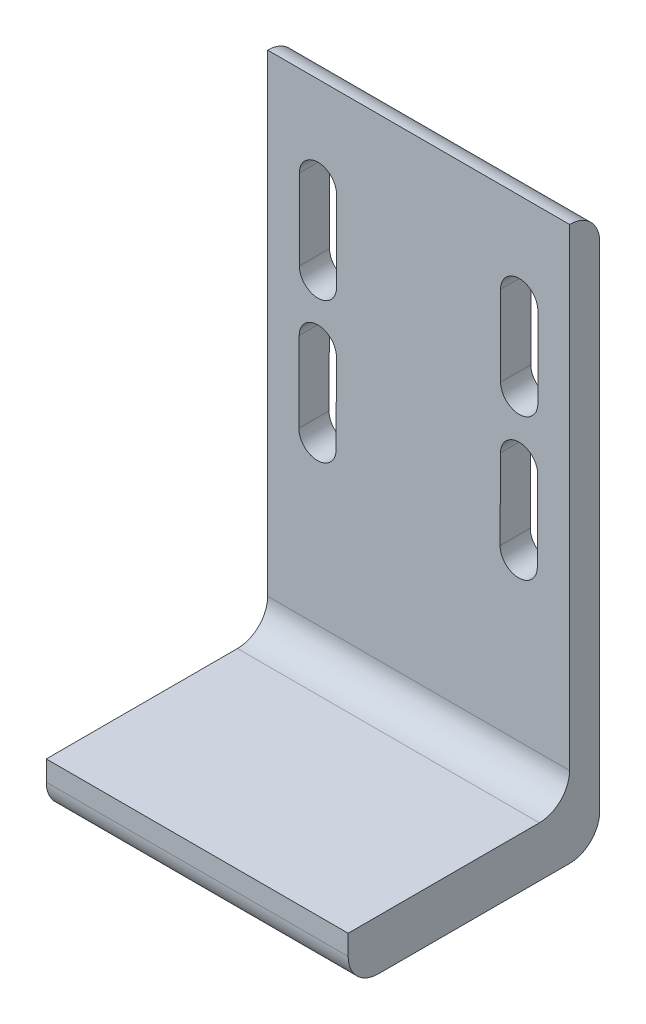
from build123d import *

# Parameters (mm, degrees)
SKETCH1_W           = 30
SKETCH1_H           = 50
BOSS_EXTRUDE1_DEPTH = 3
SKETCH2_W           = 30
SKETCH2_H           = 5
BOSS_EXTRUDE2_DEPTH = 25
FILLET1_R           = 3


with BuildPart() as part:
    # Sketch1 → Boss-Extrude1 (new body)
    with BuildSketch(Plane.XY):
        Rectangle(SKETCH1_W, SKETCH1_H)
        with BuildLine():
            Line((-11.85, 8), (-11.85, 16))
            ThreePointArc((-11.85, 16), (-10, 17.85), (-8.15, 16))
            Line((-8.15, 16), (-8.15, 8))
            ThreePointArc((-8.15, 8), (-10, 6.15), (-11.85, 8))
        make_face(mode=Mode.SUBTRACT)
        with BuildLine():
            Line((11.85, 8), (11.85, 16))
            ThreePointArc((11.85, 16), (10, 17.85), (8.15, 16))
            Line((8.15, 16), (8.15, 8))
            ThreePointArc((8.15, 8), (10, 6.15), (11.85, 8))
        make_face(mode=Mode.SUBTRACT)
        with BuildLine():
            Line((11.835217348, 1.894233852), (11.796480023, -6.105672361))
            ThreePointArc((11.796480023, -6.105672361), (9.937543705, -7.946692666), (8.0965234, -6.087756348))
            Line((8.0965234, -6.087756348), (8.135260724, 1.912149865))
            ThreePointArc((8.135260724, 1.912149865), (9.994197043, 3.75317017), (11.835217348, 1.894233852))
        make_face(mode=Mode.SUBTRACT)
        with BuildLine():
            Line((-11.864504809, 2.008993176), (-11.903242133, -5.990913037))
            ThreePointArc((-11.903242133, -5.990913037), (-10.062221828, -7.849849355), (-8.203285509, -6.008829049))
            Line((-8.203285509, -6.008829049), (-8.164548185, 1.991077164))
            ThreePointArc((-8.164548185, 1.991077164), (-10.00556849, 3.850013482), (-11.864504809, 2.008993176))
        make_face(mode=Mode.SUBTRACT)
    extrude(amount=BOSS_EXTRUDE1_DEPTH)

    # Sketch2 → Boss-Extrude2 (add)
    with BuildSketch(Plane.XY):
        with Locations((0, -27.5)):
            Rectangle(SKETCH2_W, SKETCH2_H)
    extrude(amount=BOSS_EXTRUDE2_DEPTH)

    # Fillet1
    fillet1_edges = [part.edges().sort_by_distance(p)[0] for p in [
        (0, -30, 25),
        (0, -30, 0),
        (0, -25, 3),
        (0, 25, 0),
    ]]
    fillet(fillet1_edges, radius=FILLET1_R - 0.0001)  # a hair under: the kernel refuses the full size


solid = part.part
